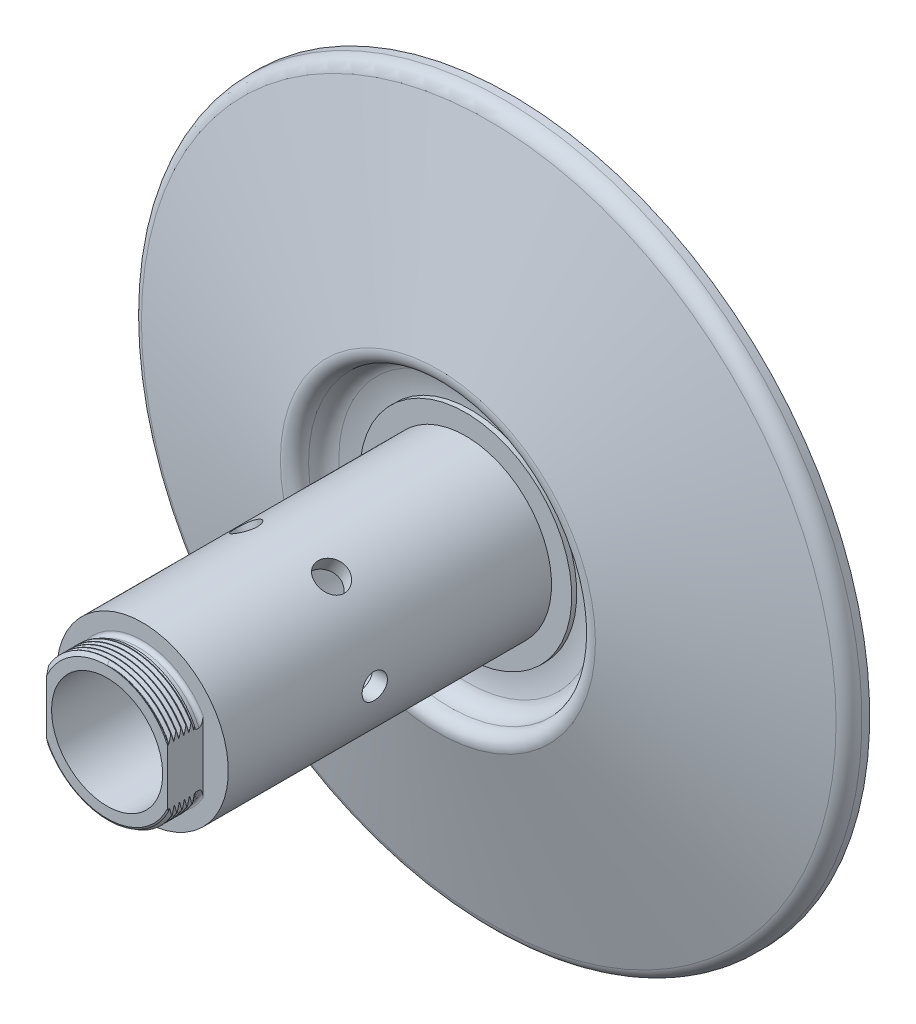
from build123d import *

# Parameters (mm, degrees)
CUT_SWEEP1_PITCH   = 1
CUT_EXTRUDE1_REACH = 130.382
SKETCH5_R          = 3
CUT_EXTRUDE2_DEPTH = 109.457364895
SKETCH6_R          = 2.5
CUT_EXTRUDE3_DEPTH = 109.457364895
CIRPATTERN1_COUNT  = 3


with BuildPart() as part:
    # Sketch1 → Revolve1 (revolve)
    with BuildSketch(Plane(origin=(0, 0, 0), x_dir=(0, 0, -1), z_dir=(1, 0, 0)), mode=Mode.PRIVATE) as revolve1_sk:
        with BuildLine():
            Line((-20, 11), (-39, 11))
            Line((-39, 11), (-39, 13.133974596))
            Line((-39, 13.133974596), (-38.5625, 13.891746825))
            Line((-38.5625, 13.891746825), (-33.9375, 13.891746825))
            Line((-33.9375, 13.891746825), (-33.5, 13.133974596))
            Line((-33.5, 13.133974596), (-32.8, 13.133974596))
            ThreePointArc((-32.8, 13.133974596), (-32.234314575, 13.368289171), (-32, 13.933974596))
            Line((-32, 13.933974596), (-32, 17))
            Line((-32, 17), (32, 17))
            Line((32, 17), (32, 21))
            Line((32, 21), (33, 21))
            ThreePointArc((33, 21), (32.838738015, 23.269128325), (32.358193589, 25.492644874))
            ThreePointArc((32.358193589, 25.492644874), (31.071932821, 27.343603025), (28.929865197, 28.045072293))
            ThreePointArc((28.929865197, 28.045072293), (26.934243135, 29.016129927), (26.497438916, 31.192057871))
            Line((26.497438916, 31.192057871), (36.568148347, 68.776457135))
            ThreePointArc((36.568148347, 68.776457135), (37.639641539, 70.380060021), (39.465925826, 71))
            Line((39.465925826, 71), (41, 71))
            Line((41, 71), (41, 69))
            Line((41, 69), (39.465925826, 69))
            ThreePointArc((39.465925826, 69), (38.857164397, 68.79335334), (38.5, 68.258819045))
            Line((38.5, 68.258819045), (28.429290569, 30.674419781))
            ThreePointArc((28.429290569, 30.674419781), (28.516651413, 30.239234192), (28.915775825, 30.045022665))
            ThreePointArc((28.915775825, 30.045022665), (32.862024573, 28.434807365), (34.5, 24.5))
            ThreePointArc((34.5, 24.5), (34.646446609, 24.146446609), (35, 24))
            ThreePointArc((35, 24), (38.535533906, 22.535533906), (40, 19))
            Line((40, 19), (37, 19))
            Line((37, 19), (37, 15))
            Line((37, 15), (21, 15))
            Line((21, 15), (21, 14))
            Line((21, 14), (-11.7, 14))
            Line((-11.7, 14), (-11.7, 14.7))
            Line((-11.7, 14.7), (-13, 14.7))
            Line((-13, 14.7), (-13, 14))
            Line((-13, 14), (-20, 14))
            Line((-20, 14), (-20, 11))
        make_face()
    revolve(revolve1_sk.sketch.rotate(Axis((0, 0, 0), (0, 0, 1)), 90), axis=Axis((0, 0, 0), (0, 0, 1)))

    # Cut-Sweep1: the profile of Sketch3 profile screwed along a right-hand helix of 5.5 turns, 8 arcs to a turn; built about Z, then put on its axis
    cut_sweep1_z = Axis((0, 0, 0), (0, 0, 1))
    cut_sweep1_corners = [(13.891746825, 0, -0.4375), (14.0003, 0, -0.4375), (14.0003, 0, 0.4375), (13.891746825, 0, 0.4375), (13.242227772, 0, 0.0625), (13.20614338, 0, 0), (13.242227772, 0, -0.0625)]
    with BuildLine(mode=Mode.PRIVATE) as cut_sweep1_profile:
        Line(cut_sweep1_corners[0], cut_sweep1_corners[1])
        Line(cut_sweep1_corners[1], cut_sweep1_corners[2])
        Line(cut_sweep1_corners[2], cut_sweep1_corners[3])
        Line(cut_sweep1_corners[3], cut_sweep1_corners[4])
        Line(cut_sweep1_corners[6], cut_sweep1_corners[0])
        ThreePointArc((13.242227772, 0, 0.0625), (13.215812164, 0, 0.036084392), (13.20614338, 0, 0))
        ThreePointArc((13.20614338, 0, 0), (13.215812164, 0, -0.036084392), (13.242227772, 0, -0.0625))
    cut_sweep1_cap = Face(cut_sweep1_profile.wire())
    cut_sweep1_arcs = [((13.242227772, 0, 0.0625), (13.20614338, 0, 0.041666667), (13.20614338, 0, 0), (1, 0.8660254037844453, 1)), ((13.20614338, 0, 0), (13.20614338, 0, -0.041666667), (13.242227772, 0, -0.0625), (1, 0.8660254037844453, 1))]  # start, shoulder, end, weights
    cut_sweep1_turn_angles = [0, 22.5, 45, 67.5, 90, 112.5, 135, 157.5, 180, 202.5, 225, 247.5, 270, 292.5, 315, 337.5, 360]
    cut_sweep1_turn_weights = [1, 0.9238795325112867, 1, 0.9238795325112867, 1, 0.9238795325112867, 1, 0.9238795325112867, 1, 0.9238795325112867, 1, 0.9238795325112867, 1, 0.9238795325112867, 1, 0.9238795325112867, 1]
    cut_sweep1_turn_rails = [Edge.make_bspline([Vector(p[0], p[1], 0).rotate(cut_sweep1_z, cut_sweep1_turn_angles[k]) / cut_sweep1_turn_weights[k] + Vector(0, 0, p[2] + CUT_SWEEP1_PITCH * cut_sweep1_turn_angles[k] / 360) for k in range(17)], [0, 0, 0, 1, 1, 2, 2, 3, 3, 4, 4, 5, 5, 6, 6, 7, 7, 8, 8, 8], 2, cut_sweep1_turn_weights) for p in cut_sweep1_corners]
    cut_sweep1_turn_sides = [*[Face.make_surface_from_curves(cut_sweep1_turn_rails[p[0]], cut_sweep1_turn_rails[p[1]]) for p in [(0, 1), (1, 2), (2, 3), (3, 4), (6, 0)]], *[Face.make_bezier_surface([[Vector(p[j][0], p[j][1], 0).rotate(cut_sweep1_z, cut_sweep1_turn_angles[2 * i + k]) / cut_sweep1_turn_weights[2 * i + k] + Vector(0, 0, p[j][2] + CUT_SWEEP1_PITCH * cut_sweep1_turn_angles[2 * i + k] / 360) for k in range(3)] for j in range(3)], [[p[3][j] * cut_sweep1_turn_weights[2 * i + k] for k in range(3)] for j in range(3)]) for p in cut_sweep1_arcs for i in range(8)]]
    cut_sweep1_last_angles = [1800, 1822.5, 1845, 1867.5, 1890, 1912.5, 1935, 1957.5, 1980]
    cut_sweep1_last_weights = [1, 0.9238795325112867, 1, 0.9238795325112867, 1, 0.9238795325112867, 1, 0.9238795325112602, 1]
    cut_sweep1_last_rails = [Edge.make_bspline([Vector(p[0], p[1], 0).rotate(cut_sweep1_z, cut_sweep1_last_angles[k]) / cut_sweep1_last_weights[k] + Vector(0, 0, p[2] + CUT_SWEEP1_PITCH * cut_sweep1_last_angles[k] / 360) for k in range(9)], [0, 0, 0, 1, 1, 2, 2, 3, 3, 4, 4, 4], 2, cut_sweep1_last_weights) for p in cut_sweep1_corners]
    cut_sweep1_last_sides = [*[Face.make_surface_from_curves(cut_sweep1_last_rails[p[0]], cut_sweep1_last_rails[p[1]]) for p in [(0, 1), (1, 2), (2, 3), (3, 4), (6, 0)]], *[Face.make_bezier_surface([[Vector(p[j][0], p[j][1], 0).rotate(cut_sweep1_z, cut_sweep1_last_angles[2 * i + k]) / cut_sweep1_last_weights[2 * i + k] + Vector(0, 0, p[j][2] + CUT_SWEEP1_PITCH * cut_sweep1_last_angles[2 * i + k] / 360) for k in range(3)] for j in range(3)], [[p[3][j] * cut_sweep1_last_weights[2 * i + k] for k in range(3)] for j in range(3)]) for p in cut_sweep1_arcs for i in range(4)]]
    cut_sweep1 = Plane(origin=(0, 0, 39), x_dir=(0, 1, 0), z_dir=(0, 0, -1)) * Solid(Shell([*[p.moved(Location((0, 0, CUT_SWEEP1_PITCH * i))) for i in range(5) for p in cut_sweep1_turn_sides], *cut_sweep1_last_sides, cut_sweep1_cap, cut_sweep1_cap.rotate(cut_sweep1_z, 1980).moved(Location((0, 0, CUT_SWEEP1_PITCH * 1980 / 360)))]))
    add(cut_sweep1, mode=Mode.SUBTRACT)

    # Cut-Extrude1: up to this face of the body (flat: up to its plane)
    cut_extrude1_end = Plane(part.part.faces().sort_by_distance((14.414807207, 0, 32))[0])
    # Sketch4 → Cut-Extrude1 (cut, up to the picked face)
    with BuildSketch(Plane.XY.offset(39), mode=Mode.PRIVATE) as cut_extrude1_sk1:
        with BuildLine():
            Line((-12, 12.041594579), (-12, -12.041594579))
            ThreePointArc((-12, -12.041594579), (-17, 0), (-12, 12.041594579))
        make_face()
    cut_extrude1_tool1 = split(extrude(cut_extrude1_sk1.sketch, amount=-CUT_EXTRUDE1_REACH, mode=Mode.PRIVATE), bisect_by=cut_extrude1_end, keep=Keep.BOTH, mode=Mode.PRIVATE)
    # Sketch4 → Cut-Extrude1 (cut, up to the picked face)
    with BuildSketch(Plane.XY.offset(39), mode=Mode.PRIVATE) as cut_extrude1_sk2:
        with BuildLine():
            Line((12, 12.041594579), (12, -12.041594579))
            ThreePointArc((12, -12.041594579), (17, 0), (12, 12.041594579))
        make_face()
    cut_extrude1_tool2 = split(extrude(cut_extrude1_sk2.sketch, amount=-CUT_EXTRUDE1_REACH, mode=Mode.PRIVATE), bisect_by=cut_extrude1_end, keep=Keep.BOTH, mode=Mode.PRIVATE)
    add(cut_extrude1_tool1.solids().sort_by(Axis((-14.027569, 0, 39), (0, 0, -1)))[0], mode=Mode.SUBTRACT)
    add(cut_extrude1_tool2.solids().sort_by(Axis((14.027569, 0, 39), (0, 0, -1)))[0], mode=Mode.SUBTRACT)

    # Sketch5 → Cut-Extrude2 (cut, through all)
    with BuildSketch(Plane(origin=(0, 0, 0), x_dir=(0, 0, -1), z_dir=(1, 0, 0))):
        with Locations((-3, 0)):
            Circle(SKETCH5_R)
    cut_extrude2 = extrude(amount=-CUT_EXTRUDE2_DEPTH, mode=Mode.SUBTRACT)

    # Sketch6 → Cut-Extrude3 (cut, through all)
    with BuildSketch(Plane(origin=(0, 0, 0), x_dir=(0, 0, -1), z_dir=(0.499999999999998, -0.8660254037844398, 0))):
        with Locations(Location((-3, 0, 0), (0, 0, 90))):
            Circle(SKETCH6_R)
    cut_extrude3 = extrude(amount=-CUT_EXTRUDE3_DEPTH, mode=Mode.SUBTRACT)

    # CirPattern1: Cut-Extrude2, Cut-Extrude3 ×3 about axis
    cirpattern1_axis = Axis((0, 0, 0), (0, 0, -1))
    add([cut_extrude2.rotate(cirpattern1_axis, i * 360 / CIRPATTERN1_COUNT) for i in range(1, CIRPATTERN1_COUNT)], mode=Mode.SUBTRACT)
    add([cut_extrude3.rotate(cirpattern1_axis, i * 360 / CIRPATTERN1_COUNT) for i in range(1, CIRPATTERN1_COUNT)], mode=Mode.SUBTRACT)


solid = part.part
